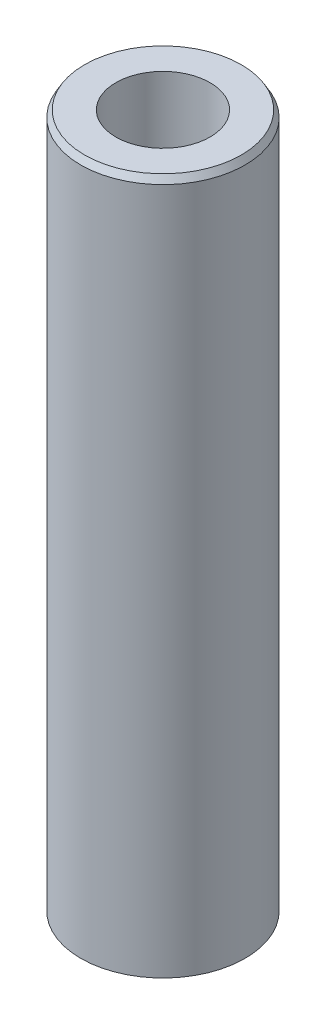
from build123d import *
from OCP.BRepFilletAPI import BRepFilletAPI_MakeChamfer

# Parameters (mm, degrees)
SKETCH1_R           = 57.5
BOSS_EXTRUDE1_DEPTH = 488.0982731
SKETCH2_R           = 32.970457894
CUT_EXTRUDE1_DEPTH  = 495.825650308
CHAMFER1_SIZE       = 4.681335049
CHAMFER1_SIZE2      = 2.702770051


with BuildPart() as part:
    # Sketch1 → Boss-Extrude1 (new body)
    with BuildSketch(Plane(origin=(0, 0, 0), x_dir=(1, 0, 0), z_dir=(0, 1, 0))):
        Circle(SKETCH1_R)
    extrude(amount=BOSS_EXTRUDE1_DEPTH)

    # Sketch2 → Cut-Extrude1 (cut, through all)
    with BuildSketch(Plane(origin=(0, 0, 0), x_dir=(1, 0, 0), z_dir=(0, 1, 0))):
        Circle(SKETCH2_R)
    extrude(amount=CUT_EXTRUDE1_DEPTH, mode=Mode.SUBTRACT)

    # Chamfer1: one chamfer whose edges measure the first distance from different faces: ONE call of the kernel's chamfer builder (chamfer() names one face for all edges)
    chamfer1_edges_1 = [part.edges().sort_by_distance(p)[0] for p in [
        (-57.5, 488.0982731, 0),
    ]]
    chamfer1_side_1 = [part.faces().sort_by_distance(p)[0] for p in [
        (-57.5, 244.04913655, 0),
    ]]
    chamfer1_edges_2 = [part.edges().sort_by_distance(p)[0] for p in [
        (-57.5, 0, 0),
    ]]
    chamfer1_side_2 = [part.faces().sort_by_distance(p)[0] for p in [
        (-55.873654403, 0, 0),
    ]]
    chamfer1 = BRepFilletAPI_MakeChamfer(part.part.solid().wrapped)
    for e in chamfer1_edges_1:
        chamfer1.Add(CHAMFER1_SIZE, CHAMFER1_SIZE2, e.wrapped, chamfer1_side_1[0].wrapped)  # the first distance lies on this face
    for e in chamfer1_edges_2:
        chamfer1.Add(CHAMFER1_SIZE, CHAMFER1_SIZE2, e.wrapped, chamfer1_side_2[0].wrapped)  # the first distance lies on this face
    add(Compound.cast(chamfer1.Shape()), mode=Mode.REPLACE)


solid = part.part
